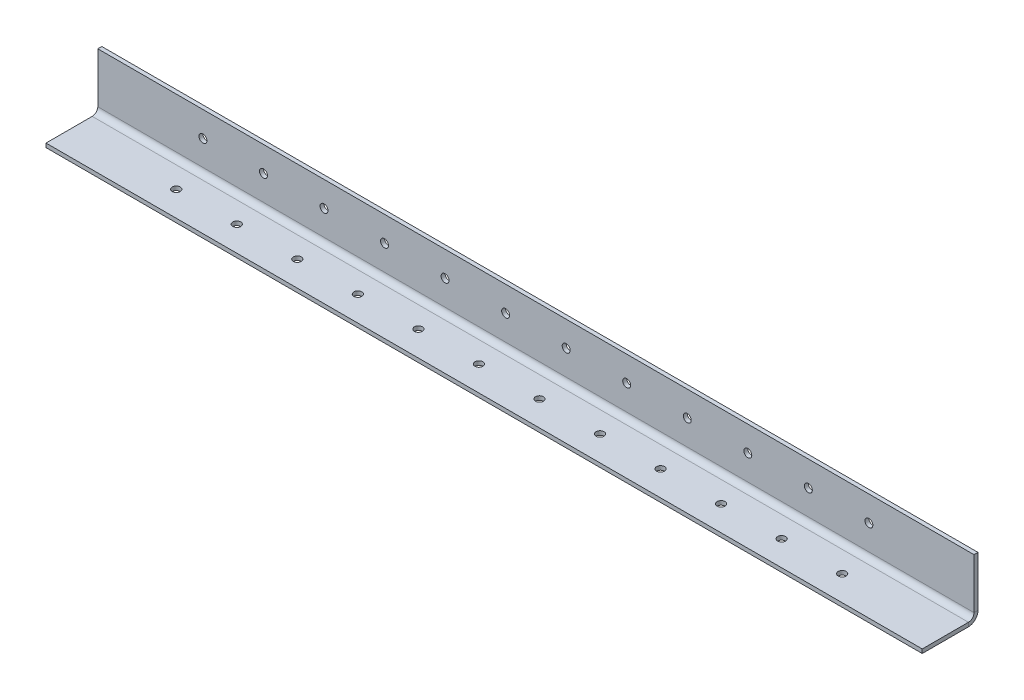
from build123d import *

# Parameters (mm, degrees)
SKETCH1_W                    = 2200
SKETCH1_H                    = 150
BASE_FLANGE1_DEPTH           = 10
EDGE_FLANGE1_STRIP_W         = 68
EDGE_FLANGE1_STRIP_H         = 10
EDGE_FLANGE1_STRIP_CUT_DEPTH = 2200
EDGE_FLANGE1_DEPTH           = 2200
SKETCH12_R                   = 10
CUT_EXTRUDE1_DEPTH           = 10
SKETCH13_R                   = 10
CUT_EXTRUDE2_DEPTH           = 10
LPATTERN1_COUNT              = 12
LPATTERN1_PITCH              = 152


# Sheet-metal steps are written as plain solids
with BuildPart() as part:
    # Sketch1 → Base-Flange1 (new body)
    with BuildSketch(Plane.XY):
        Rectangle(SKETCH1_W, SKETCH1_H)
    extrude(amount=-BASE_FLANGE1_DEPTH)

    # Edge-Flange1 strip (across the edge) → Edge-Flange1 strip cut (cut)
    with BuildSketch(Plane(origin=(-1100, -75, 0), x_dir=(0, 1, 0), z_dir=(1, 0, 0))):
        with Locations((-10, -5)):
            Rectangle(EDGE_FLANGE1_STRIP_W, EDGE_FLANGE1_STRIP_H)
    extrude(amount=EDGE_FLANGE1_STRIP_CUT_DEPTH, mode=Mode.SUBTRACT)

    # Edge-Flange1 section (across the edge) → Edge-Flange1 (add)
    with BuildSketch(Plane(origin=(-1100, -75, 0), x_dir=(0, 1, 0), z_dir=(1, 0, 0))):
        with BuildLine():
            Line((0, 14), (0, 130))
            Line((0, 130), (10, 130))
            Line((10, 130), (10, 14))
            ThreePointArc((10, 14), (14.100505063, 4.100505063), (24, 0))
            Line((24, 0), (24, -10))
            ThreePointArc((24, -10), (7.029437252, -2.970562748), (0, 14))
        make_face()
    extrude(amount=EDGE_FLANGE1_DEPTH)

    # Sketch12 → Cut-Extrude1 (cut)
    with BuildSketch(Plane(origin=(0, -75, 0), x_dir=(-1, 0, 0), z_dir=(0, -1, 0))):
        with Locations(Location((836, -67, 0), (0, 0, 90))):
            Circle(SKETCH12_R)
    cut_extrude1 = extrude(amount=-CUT_EXTRUDE1_DEPTH, mode=Mode.SUBTRACT)

    # Sketch13 → Cut-Extrude2 (cut)
    with BuildSketch(Plane(origin=(0, 0, -10), x_dir=(-1, 0, 0), z_dir=(0, 0, -1))):
        with Locations((836, 12)):
            Circle(SKETCH13_R)
    cut_extrude2 = extrude(amount=-CUT_EXTRUDE2_DEPTH, mode=Mode.SUBTRACT)

    # LPattern1: Cut-Extrude1, Cut-Extrude2 ×12
    with Locations(*[(i * LPATTERN1_PITCH, 0, 0) for i in range(1, LPATTERN1_COUNT)]):
        add(cut_extrude1, mode=Mode.SUBTRACT)
        add(cut_extrude2, mode=Mode.SUBTRACT)


solid = part.part
